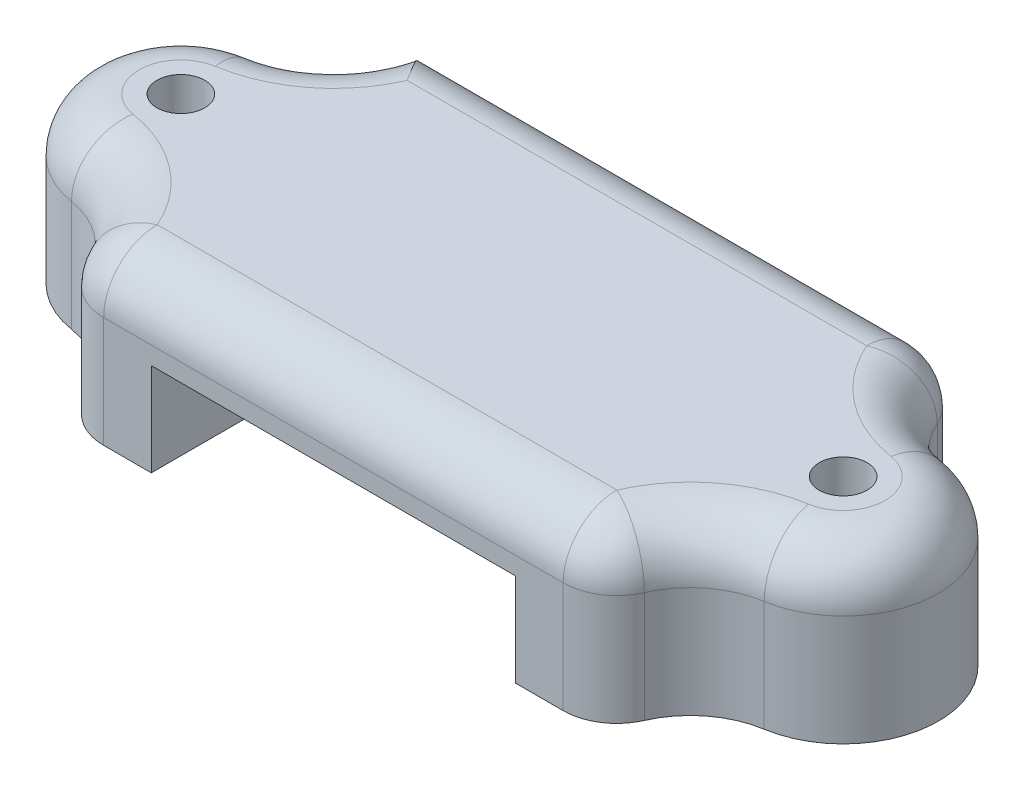
from build123d import *

# Parameters (mm, degrees)
SKETCH1_W             = 6.35
SKETCH1_H             = 25.4
BOSS_EXTRUDE1_DEPTH   = 6.604
BOSS_EXTRUDE1_2_DEPTH = 6.604
SKETCH2_W             = 38.608
SKETCH2_H             = 25.4
BOSS_EXTRUDE2_DEPTH   = 5.08
SKETCH3_W             = 13.97
SKETCH3_H             = 6.35
BOSS_EXTRUDE3_DEPTH   = 6.604
SKETCH4_R             = 2.159
CUT_EXTRUDE1_DEPTH    = 2.54
SKETCH5_R             = 1.7018
BOSS_EXTRUDE4_DEPTH   = 11.684
FILLET1_R             = 6.35
FILLET2_R             = 3.81
FILLET3_R             = 1.27


with BuildPart() as part:
    # Sketch1 → Boss-Extrude1 (new body)
    with BuildSketch(Plane(origin=(0, 0, 0), x_dir=(1, 0, 0), z_dir=(0, 1, 0))):
        with Locations((16.129, 12.7)):
            Rectangle(SKETCH1_W, SKETCH1_H)
    extrude(amount=BOSS_EXTRUDE1_DEPTH)



with BuildPart() as body_2:
    # Sketch1 → Boss-Extrude1 2 (new body)
    with BuildSketch(Plane(origin=(0, 0, 0), x_dir=(1, 0, 0), z_dir=(0, 1, 0))):
        with Locations((-16.129, 12.7)):
            Rectangle(SKETCH1_W, SKETCH1_H)
    extrude(amount=BOSS_EXTRUDE1_2_DEPTH)


with BuildPart() as part_1:
    add(part.part)

    add(body_2.part)  # Boss-Extrude2 merges body 2
    # Sketch2 → Boss-Extrude2 (add)
    with BuildSketch(Plane(origin=(0, 6.604, 0), x_dir=(1, 0, 0), z_dir=(0, 1, 0))):
        with Locations((0, 12.7)):
            Rectangle(SKETCH2_W, SKETCH2_H)
    extrude(amount=BOSS_EXTRUDE2_DEPTH)

    # Sketch3 → Boss-Extrude3 (add)
    with BuildSketch(Plane.XZ.offset(-6.604)):
        with Locations((0, -22.225)):
            Rectangle(SKETCH3_W, SKETCH3_H)
    extrude(amount=BOSS_EXTRUDE3_DEPTH)

    # Sketch4 → Cut-Extrude1 (cut)
    with BuildSketch(Plane.XY.offset(-19.05)):
        with Locations((3.81, 3.302)):
            Circle(SKETCH4_R)
        with Locations((-3.81, 3.302)):
            Circle(SKETCH4_R)
    extrude(amount=-CUT_EXTRUDE1_DEPTH, mode=Mode.SUBTRACT)

    # Sketch5 → Boss-Extrude4 (add)
    # profile 1 of 2: a face of its own
    with BuildSketch(Plane(origin=(0, 11.684, 0), x_dir=(1, 0, 0), z_dir=(0, 1, 0))):
        with BuildLine():
            Line((-19.304, 17.985297981), (-19.304, 7.414702019))
            ThreePointArc((-19.304, 7.414702019), (-30.335321913, 12.7), (-19.304, 17.985297981))
        make_face()
        with Locations(Location((-23.553521913, 12.7, 0), (0, 0, 270))):
            Circle(SKETCH5_R, mode=Mode.SUBTRACT)
    # profile 2 of 2: a face of its own
    with BuildSketch(Plane(origin=(0, 11.684, 0), x_dir=(1, 0, 0), z_dir=(0, 1, 0))):
        with BuildLine():
            Line((19.304, 17.985297981), (19.304, 7.414702019))
            ThreePointArc((19.304, 7.414702019), (30.335321913, 12.7), (19.304, 17.985297981))
        make_face()
        with Locations(Location((23.553521913, 12.7, 0), (0, 0, 270))):
            Circle(SKETCH5_R, mode=Mode.SUBTRACT)
    extrude(amount=-BOSS_EXTRUDE4_DEPTH)

    # Fillet1
    # the kernel refuses this fillet: 6.35 mm, written as the material it adds along each edge
    with BuildSketch(Plane(origin=(-19.304, 11.684, -7.414702019), x_dir=(0, 0, 1), z_dir=(0, -1, 0)), Plane(origin=(19.304, 11.684, -17.985297981), x_dir=(0, 0, -1), z_dir=(0, -1, 0))) as fillet1_piece_1:
        with BuildLine():
            CenterArc((7.678309884, 6.344526057), FILLET1_R, 189.180006139, 78.44078763)
            Line((1.409640703, 5.331467961), (1.28426732, 5.311206799))
            ThreePointArc((1.28426732, 5.311206799), (1.148418354, 2.548446621), (-0.098975618, 0.079579062))
            Line((-0.098975618, 0.079579062), (0, -0.127))
            ThreePointArc((0, -0.127), (3.707351009, -0.127), (7.409429861, -0.126890521))
            Line((7.409429861, -0.126890521), (7.414702019, 0))
        make_face()
    extrude(amount=11.684)
    with BuildSketch(Plane(origin=(-19.304, 11.684, -17.985297981), x_dir=(0, 0, -1), z_dir=(0, -1, 0)), Plane(origin=(19.304, 11.684, -7.414702019), x_dir=(0, 0, 1), z_dir=(0, -1, 0))) as fillet1_piece_2:
        with BuildLine():
            CenterArc((7.678309884, -6.344526057), FILLET1_R, 92.379206231, 78.44078763)
            Line((1.409640703, -5.331467961), (1.28426732, -5.311206799))
            ThreePointArc((1.28426732, -5.311206799), (1.148418354, -2.548446621), (-0.098975618, -0.079579062))
            Line((-0.098975618, -0.079579062), (0, 0.127))
            ThreePointArc((0, 0.127), (3.707351009, 0.127), (7.409429861, 0.126890521))
            Line((7.409429861, 0.126890521), (7.414702019, 0))
        make_face()
    extrude(amount=11.684)

    # Fillet2
    fillet2_edges = [part_1.edges().sort_by_distance(p)[0] for p in [
        (20.899978754, 11.684, -21.447709562),
        (-19.304, 5.842, 0),
        (0, 11.684, 0),
        (0, 11.684, -25.4),
        (19.304, 5.842, 0),
        (19.304, 5.842, -25.4),
        (-30.335321913, 11.684, -12.7),
        (30.335321913, 11.684, -12.7),
        (-20.899978754, 11.684, -3.952290438),
        (-20.899978754, 11.684, -21.447709562),
        (20.899978754, 11.684, -3.952290438),
    ]]
    fillet(fillet2_edges, radius=FILLET2_R)

    # Fillet3
    fillet3_edges = [part_1.edges().sort_by_distance(p)[0] for p in [
        (0, 6.604, -19.05),
    ]]
    fillet(fillet3_edges, radius=FILLET3_R)


solid = part_1.part
